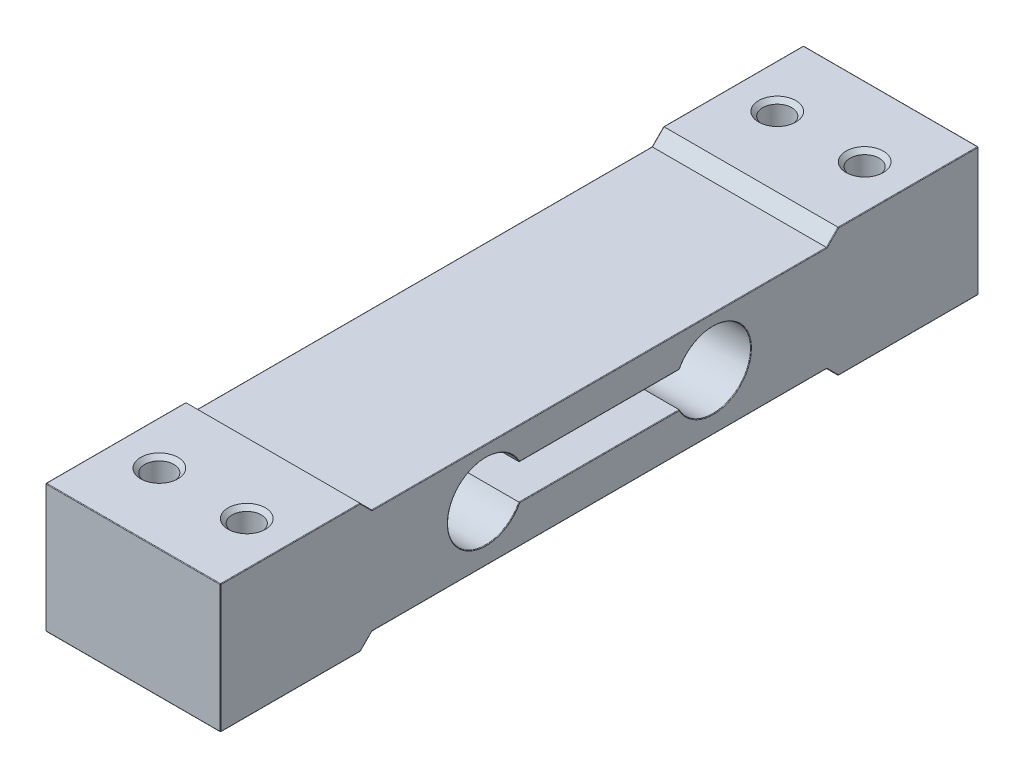
from build123d import *

# Parameters (mm, degrees)
EXTRUDE_1_DEPTH      = 15
EXTRUDE_1_DEPTH_BACK = 15
CUT_EXTRUDE_1_DEPTH  = 45
SKETCH_12_R          = 2.5
CUT_EXTRUDE_2_DEPTH  = 40
CHAMFER_1_SIZE       = 0.7
FILLET_1_R           = 0.1
SKETCH_13_R          = 1.75
CUT_EXTRUDE_3_DEPTH  = 10
SKETCH_15_R          = 1.75
EXTRUDE_2_DEPTH      = 15


with BuildPart() as part:
    # Эскиз1 → Бобышка-Вытянуть1 (new, two sides: drawn at the far end of the back side and taken through both)
    with BuildSketch(Plane(origin=(0, 0, 0), x_dir=(0, 0, -1), z_dir=(1, 0, 0)).offset(-EXTRUDE_1_DEPTH_BACK)):
        Polygon((24, 22), (26, 20), (104, 20), (106, 22), (130, 22), (130, 0), (106, 0), (104, 2), (26, 2), (24, 0), (0, 0), (0, 22), align=None)
    extrude(amount=EXTRUDE_1_DEPTH + EXTRUDE_1_DEPTH_BACK)

    # Эскиз2 → Вырез-Вытянуть1 (cut)
    with BuildSketch(Plane(origin=(15, 0, 0), x_dir=(0, 0, -1), z_dir=(1, 0, 0))):
        with BuildLine():
            Line((51.266281297, 14.526622722), (78.733718703, 14.526622722))
            ThreePointArc((78.733718703, 14.526622722), (91, 11.526622722), (78.733718703, 8.526622722))
            Line((78.733718703, 8.526622722), (51.266281297, 8.526622722))
            ThreePointArc((51.266281297, 8.526622722), (39, 11.526622722), (51.266281297, 14.526622722))
        make_face()
    extrude(amount=-CUT_EXTRUDE_1_DEPTH, mode=Mode.SUBTRACT)

    # Эскиз12 → Вырез-Вытянуть2 (cut)
    with BuildSketch(Plane.XZ):
        with Locations((7.5, -118)):
            Circle(SKETCH_12_R)
        with Locations((-7.5, -118)):
            Circle(SKETCH_12_R)
        with Locations((7.5, -12)):
            Circle(SKETCH_12_R)
        with Locations((-7.5, -12)):
            Circle(SKETCH_12_R)
    extrude(amount=-CUT_EXTRUDE_2_DEPTH, mode=Mode.SUBTRACT)

    # Фаска1
    chamfer_1_edges = [part.edges().sort_by_distance(p)[0] for p in [
        (-10, 0, -118),
        (-10, 22, -118),
        (5, 0, -118),
        (5, 22, -118),
        (5, 0, -12),
        (5, 22, -12),
        (-10, 0, -12),
        (-10, 22, -12),
    ]]
    chamfer(chamfer_1_edges, length=CHAMFER_1_SIZE)

    # Скругление1
    fillet_1_edges = [part.edges().sort_by_distance(p)[0] for p in [
        (-15, 0, -118),
        (-15, 22, -118),
        (-15, 21, -105),
        (-15, 20, -65),
        (-15, 21, -25),
        (-15, 22, -12),
        (-15, 0, -12),
        (-15, 1, -25),
        (-15, 2, -65),
        (-15, 1, -105),
        (-15, 11.526622722, -39),
        (-15, 14.526622722, -65),
        (-15, 11.526622722, -91),
        (-15, 8.526622722, -65),
        (-15, 11, -130),
        (0, 0, -130),
        (0, 22, -130),
        (-15, 11, 0),
        (0, 22, 0),
        (0, 0, 0),
        (15, 2, -65),
        (15, 1, -25),
        (15, 0, -12),
        (15, 11, 0),
        (15, 22, -12),
        (15, 21, -25),
        (15, 20, -65),
        (15, 21, -105),
        (15, 22, -118),
        (15, 11, -130),
        (15, 0, -118),
        (15, 1, -105),
        (15, 14.526622722, -65),
        (15, 11.526622722, -39),
        (15, 8.526622722, -65),
        (15, 11.526622722, -91),
    ]]
    fillet(fillet_1_edges, radius=FILLET_1_R)

    # Эскиз13 → Вырез-Вытянуть3 (cut)
    with BuildSketch(Plane.ZY.offset(15)):
        with Locations((-123.9, 11)):
            Circle(SKETCH_13_R)
    extrude(amount=-CUT_EXTRUDE_3_DEPTH, mode=Mode.SUBTRACT)


with BuildPart() as body_2:
    # Эскиз15 → Бобышка-Вытянуть2 (new body)
    with BuildSketch(Plane.ZY.offset(5)):
        with Locations((-123.9, 11)):
            Circle(SKETCH_15_R)
    extrude(amount=EXTRUDE_2_DEPTH)


solid = Compound([part.part, body_2.part])
